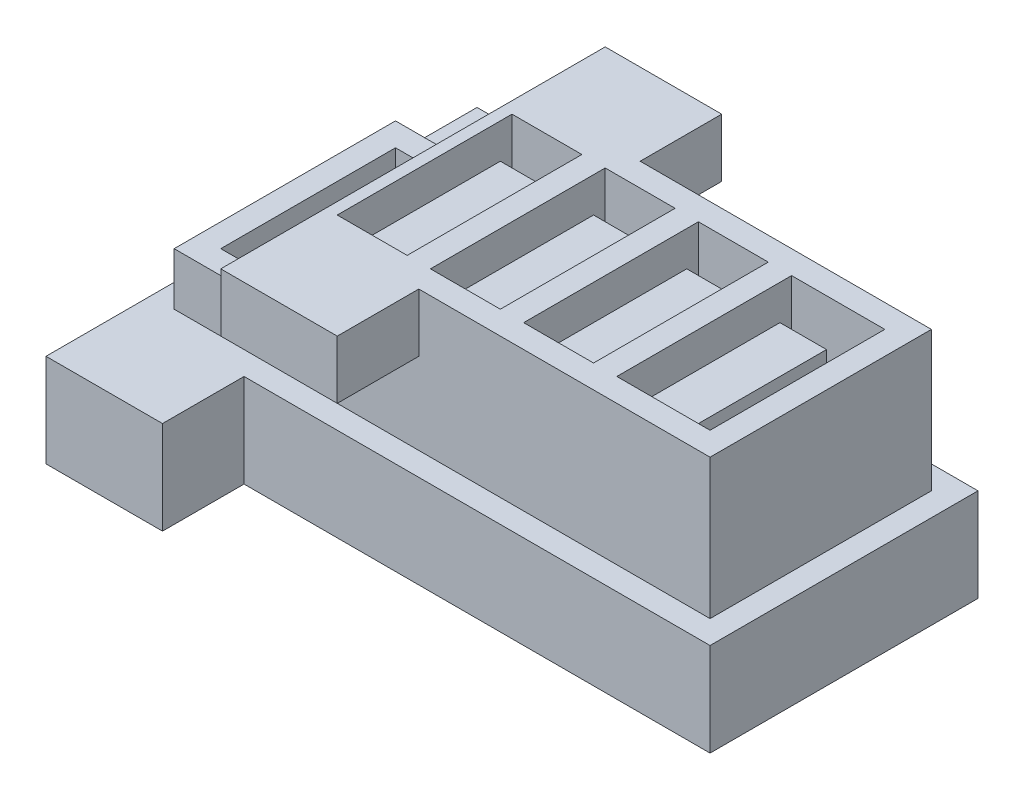
from build123d import *

# Parameters (mm, degrees)
SKETCH1_W                = 6
SKETCH1_H                = 15
BOSS_EXTRUDE1_DEPTH      = 15
SKETCH2_W                = 4
SKETCH2_H                = 11
CUT_EXTRUDE1_DEPTH       = 13
SKETCH3_W                = 15
SKETCH3_H                = 4
BOSS_EXTRUDE2_DEPTH      = 2
LPATTERN1_COUNT          = 4
LPATTERN1_PITCH          = 8
SKETCH4_W                = 15
SKETCH4_H                = 7.5
BOSS_EXTRUDE3_DEPTH      = 8
SKETCH5_W                = 4
SKETCH5_H                = 11
CUT_EXTRUDE2_DEPTH       = 5.5
SKETCH6_W                = 15
SKETCH6_H                = 15
BOSS_EXTRUDE4_DEPTH      = 2
SKETCH7_W                = 36
SKETCH7_H                = 2
CUT_EXTRUDE3_DEPTH       = 2
BOSS_EXTRUDE5_DEPTH      = 5
BOSS_EXTRUDE5_DEPTH_BACK = 15
SKETCH8_W                = 35
SKETCH8_H                = 19
BOSS_EXTRUDE6_DEPTH      = 5
BOSS_EXTRUDE6_DEPTH_BACK = 7.5
SKETCH9_W                = 11
SKETCH9_H                = 19
SPLIT1_START             = -5
SPLIT1_OUTLINE_W         = 46
SPLIT1_OUTLINE_H         = 19
SPLIT1_DEPTH             = 5
SPLIT1_2_OUTLINE_W       = 4
SPLIT1_2_OUTLINE_H       = 11
SPLIT1_2_DEPTH           = 13
SPLIT1_3_OUTLINE_W       = 4
SPLIT1_3_OUTLINE_H       = 2
SPLIT1_3_DEPTH           = 2
SPLIT1_START_2           = -13
SPLIT1_4_DEPTH           = 11
SPLIT1_START_3           = -17
SPLIT1_5_OUTLINE_W       = 46
SPLIT1_5_OUTLINE_H       = 5
SPLIT1_5_DEPTH           = 19
SPLIT1_START_4           = -8.5
SPLIT1_6_OUTLINE_W       = 4
SPLIT1_6_OUTLINE_H       = 2
SPLIT1_6_DEPTH           = 2
SKETCH15_W               = 10
SKETCH15_H               = 5
BOSS_EXTRUDE13_DEPTH     = 7
SKETCH16_W               = 10
SKETCH16_H               = 5
BOSS_EXTRUDE14_DEPTH     = 7
SKETCH17_W               = 50
SKETCH17_H               = 23
SKETCH17_W_2             = 46
SKETCH17_H_2             = 19
BOSS_EXTRUDE15_DEPTH     = 8
SKETCH18_W               = 10
SKETCH18_H               = 8
BOSS_EXTRUDE16_DEPTH     = 7
SKETCH19_W               = 10
SKETCH19_H               = 8
BOSS_EXTRUDE17_DEPTH     = 7


# Read off the part's stored shape, not the designer's step: Split1
with BuildPart() as part:
    # Sketch1 → Boss-Extrude1 (new body)
    with BuildSketch(Plane(origin=(0, 0, 0), x_dir=(1, 0, 0), z_dir=(0, 1, 0))):
        with Locations((3, 7.5)):
            Rectangle(SKETCH1_W, SKETCH1_H)
    extrude(amount=BOSS_EXTRUDE1_DEPTH)

    # Sketch2 → Cut-Extrude1 (cut)
    with BuildSketch(Plane.XZ):
        with Locations((3, -7.5)):
            Rectangle(SKETCH2_W, SKETCH2_H)
    extrude(amount=-CUT_EXTRUDE1_DEPTH, mode=Mode.SUBTRACT)

    # Sketch3 → Boss-Extrude2 (add)
    with BuildSketch(Plane.ZY):
        with Locations((-7.5, 2)):
            Rectangle(SKETCH3_W, SKETCH3_H)
    extrude(amount=BOSS_EXTRUDE2_DEPTH)


with BuildPart() as lpattern1_1:
    # LPattern1: pattern copy
    add(part.part.moved(Location(Vector(-1, 0, 0) * (1 * LPATTERN1_PITCH))))


with BuildPart() as lpattern1_2:
    # LPattern1: pattern copy
    add(part.part.moved(Location(Vector(-1, 0, 0) * (2 * LPATTERN1_PITCH))))


with BuildPart() as lpattern1_3:
    # LPattern1: pattern copy
    add(part.part.moved(Location(Vector(-1, 0, 0) * (3 * LPATTERN1_PITCH))))

    # Sketch4 → Boss-Extrude3 (add)
    with BuildSketch(Plane.ZY.offset(26)):
        with Locations((-7.5, 3.75)):
            Rectangle(SKETCH4_W, SKETCH4_H)
    extrude(amount=BOSS_EXTRUDE3_DEPTH)

    # Sketch5 → Cut-Extrude2 (cut)
    with BuildSketch(Plane.XZ):
        with Locations((-29, -7.5)):
            Rectangle(SKETCH5_W, SKETCH5_H)
    extrude(amount=-CUT_EXTRUDE2_DEPTH, mode=Mode.SUBTRACT)


with BuildPart() as lpattern1_1_1:
    add(lpattern1_1.part)

    # Combine1: union LPattern1_2, LPattern1_3, part
    add(lpattern1_2.part)
    add(lpattern1_3.part)
    add(part.part)

    # Sketch6 → Boss-Extrude4 (add)
    with BuildSketch(Plane(origin=(6, 0, 0), x_dir=(0, 0, -1), z_dir=(1, 0, 0))):
        with Locations((7.5, 7.5)):
            Rectangle(SKETCH6_W, SKETCH6_H)
    extrude(amount=BOSS_EXTRUDE4_DEPTH)

    # Sketch7 → Cut-Extrude3 (cut)
    with BuildSketch(Plane.XZ):
        with Locations((-13, -7.5)):
            Rectangle(SKETCH7_W, SKETCH7_H)
    extrude(amount=-CUT_EXTRUDE3_DEPTH, mode=Mode.SUBTRACT)


with BuildPart() as body_2:
    # Sketch8 → Boss-Extrude5 (new, two sides: drawn at the far end of the back side and taken through both)
    with BuildSketch(Plane.XZ.offset(-BOSS_EXTRUDE5_DEPTH_BACK)):
        with Locations((-7.5, -7.5)):
            Rectangle(SKETCH8_W, SKETCH8_H)
    extrude(amount=BOSS_EXTRUDE5_DEPTH + BOSS_EXTRUDE5_DEPTH_BACK)


with BuildPart() as body_3:
    # Sketch9 → Boss-Extrude6 (new, two sides: drawn at the far end of the back side and taken through both)
    with BuildSketch(Plane.XZ.offset(-BOSS_EXTRUDE6_DEPTH_BACK)):
        with Locations((-30.5, -7.5)):
            Rectangle(SKETCH9_W, SKETCH9_H)
    extrude(amount=BOSS_EXTRUDE6_DEPTH + BOSS_EXTRUDE6_DEPTH_BACK)


with BuildPart() as body_2_1:
    add(body_2.part)

    # Combine3: union body 3
    add(body_3.part)

    # Combine4: cut LPattern1_1
    add(lpattern1_1_1.part, mode=Mode.SUBTRACT)

    # Split1 outline → Split1 (cut)
    with BuildSketch(Plane(origin=(0, 0, 0), x_dir=(1, 0, 0), z_dir=(0, 1, 0)).offset(SPLIT1_START)):
        with Locations((-13, 7.5)):
            Rectangle(SPLIT1_OUTLINE_W, SPLIT1_OUTLINE_H)
    extrude(amount=SPLIT1_DEPTH, mode=Mode.SUBTRACT)

    # Split1 2 outline → Split1 2 (cut)
    with BuildSketch(Plane(origin=(0, 0, 0), x_dir=(1, 0, 0), z_dir=(0, 1, 0))):
        with Locations((-5, 7.5)):
            Rectangle(SPLIT1_2_OUTLINE_W, SPLIT1_2_OUTLINE_H)
        with Locations((3, 7.5)):
            Rectangle(SPLIT1_2_OUTLINE_W, SPLIT1_2_OUTLINE_H)
        with Locations((-13, 7.5)):
            Rectangle(SPLIT1_2_OUTLINE_W, SPLIT1_2_OUTLINE_H)
        with Locations((-21, 7.5)):
            Rectangle(SPLIT1_2_OUTLINE_W, SPLIT1_2_OUTLINE_H)
        with Locations((-29, 7.5)):
            Rectangle(SPLIT1_2_OUTLINE_W, SPLIT1_2_OUTLINE_H)
    extrude(amount=SPLIT1_2_DEPTH, mode=Mode.SUBTRACT)

    # Split1 3 outline → Split1 3 (cut)
    with BuildSketch(Plane(origin=(0, 0, 0), x_dir=(1, 0, 0), z_dir=(0, 1, 0))):
        with Locations((-1, 7.5)):
            Rectangle(SPLIT1_3_OUTLINE_W, SPLIT1_3_OUTLINE_H)
        with Locations((-9, 7.5)):
            Rectangle(SPLIT1_3_OUTLINE_W, SPLIT1_3_OUTLINE_H)
        with Locations((-17, 7.5)):
            Rectangle(SPLIT1_3_OUTLINE_W, SPLIT1_3_OUTLINE_H)
        with Locations((-25, 7.5)):
            Rectangle(SPLIT1_3_OUTLINE_W, SPLIT1_3_OUTLINE_H)
    extrude(amount=SPLIT1_3_DEPTH, mode=Mode.SUBTRACT)

    # Sketch15 → Boss-Extrude13 (add)
    with BuildSketch(Plane.XY.offset(2)):
        with Locations((-20, 12.5)):
            Rectangle(SKETCH15_W, SKETCH15_H)
    extrude(amount=BOSS_EXTRUDE13_DEPTH)

    # Sketch16 → Boss-Extrude14 (add)
    with BuildSketch(Plane(origin=(0, 0, -17), x_dir=(-1, 0, 0), z_dir=(0, 0, -1))):
        with Locations((20, 12.5)):
            Rectangle(SKETCH16_W, SKETCH16_H)
    extrude(amount=BOSS_EXTRUDE14_DEPTH)


with BuildPart() as body_2_2:
    # Split1 4 outline → Split1 4 (new body)
    with BuildSketch(Plane.XY.offset(SPLIT1_START_2)):
        Polygon((-27, 5.5), (-31, 5.5), (-31, 0), (-36, 0), (-36, -5), (10, -5), (10, 0), (5, 0), (5, 13), (1, 13), (1, 0), (-3, 0), (-3, 13), (-7, 13), (-7, 0), (-11, 0), (-11, 13), (-15, 13), (-15, 0), (-19, 0), (-19, 13), (-23, 13), (-23, 0), (-27, 0), align=None)
    extrude(amount=SPLIT1_4_DEPTH)

    # Split1 5 outline → Split1 5 (add)
    with BuildSketch(Plane.XY.offset(SPLIT1_START_3)):
        with Locations((-13, -2.5)):
            Rectangle(SPLIT1_5_OUTLINE_W, SPLIT1_5_OUTLINE_H)
    extrude(amount=SPLIT1_5_DEPTH)

    # Split1 6 outline → Split1 6 (add)
    with BuildSketch(Plane.XY.offset(SPLIT1_START_4)):
        with Locations((-25, 1)):
            Rectangle(SPLIT1_6_OUTLINE_W, SPLIT1_6_OUTLINE_H)
        with Locations((-17, 1)):
            Rectangle(SPLIT1_6_OUTLINE_W, SPLIT1_6_OUTLINE_H)
        with Locations((-9, 1)):
            Rectangle(SPLIT1_6_OUTLINE_W, SPLIT1_6_OUTLINE_H)
        with Locations((-1, 1)):
            Rectangle(SPLIT1_6_OUTLINE_W, SPLIT1_6_OUTLINE_H)
    extrude(amount=SPLIT1_6_DEPTH)

    # Sketch17 → Boss-Extrude15 (add)
    with BuildSketch(Plane.XZ.offset(5)):
        with Locations((-13, -7.5)):
            Rectangle(SKETCH17_W, SKETCH17_H)
        with Locations((-13, -7.5)):
            Rectangle(SKETCH17_W_2, SKETCH17_H_2, mode=Mode.SUBTRACT)
    extrude(amount=-BOSS_EXTRUDE15_DEPTH)

    # Sketch18 → Boss-Extrude16 (add)
    with BuildSketch(Plane.XY.offset(4)):
        with Locations((-33, -1)):
            Rectangle(SKETCH18_W, SKETCH18_H)
    extrude(amount=BOSS_EXTRUDE16_DEPTH)

    # Sketch19 → Boss-Extrude17 (add)
    with BuildSketch(Plane(origin=(0, 0, -19), x_dir=(-1, 0, 0), z_dir=(0, 0, -1))):
        with Locations((33, -1)):
            Rectangle(SKETCH19_W, SKETCH19_H)
    extrude(amount=BOSS_EXTRUDE17_DEPTH)


solid = Compound([body_2_1.part, body_2_2.part])
